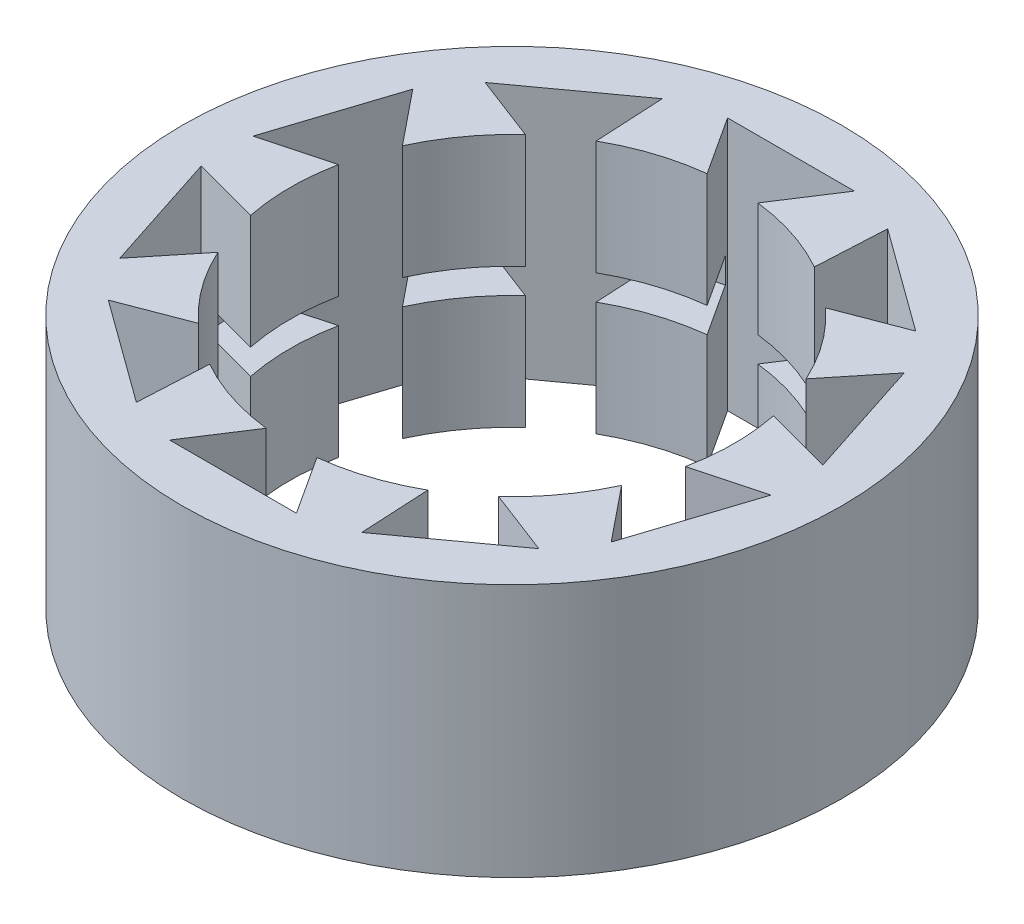
from build123d import *

# Parameters (mm, degrees)
SKETCH1_R           = 33.02
SKETCH1_R_2         = 22.225
BOSS_EXTRUDE1_DEPTH = 25.4
CAVITY1_DEPTH       = 25.4
CAVITY1_START       = 11.43
CAVITY1_2_DEPTH     = 2.54


# Read off the part's stored shape, not the designer's step: Cavity1
with BuildPart() as part:
    # Sketch1 → Boss-Extrude1 (new body)
    with BuildSketch(Plane(origin=(0, 0, 0), x_dir=(1, 0, 0), z_dir=(0, 1, 0))):
        with Locations(Location((0, 0, 0), (0, 0, 270))):
            Circle(SKETCH1_R)
        with Locations(Location((0, 0, 0), (0, 0, 270))):
            Circle(SKETCH1_R_2, mode=Mode.SUBTRACT)
    extrude(amount=BOSS_EXTRUDE1_DEPTH)

    # Cavity1 outline → Cavity1 (cut)
    with BuildSketch(Plane(origin=(0, 0, 0), x_dir=(1, 0, 0), z_dir=(0, 1, 0))):
        with BuildLine():
            Line((-6.35, -27.94), (6.35, -27.94))
            Line((6.35, -27.94), (2.54, -22.079380086))
            ThreePointArc((2.54, -22.079380086), (0, -22.225), (-2.54, -22.079380086))
            Line((-2.54, -22.079380086), (-6.35, -27.94))
        make_face()
        with BuildLine():
            Line((10.923030829, -19.355568256), (11.285462035, -26.336371175))
            Line((11.285462035, -26.336371175), (21.559977863, -18.871498471))
            Line((21.559977863, -18.871498471), (15.03283716, -16.369619174))
            ThreePointArc((15.03283716, -16.369619174), (13.063527232, -17.9804027), (10.923030829, -19.355568256))
        make_face()
        with BuildLine():
            Line((-11.285462035, -26.336371175), (-10.923030829, -19.355568256))
            ThreePointArc((-10.923030829, -19.355568256), (-13.063527232, -17.9804027), (-15.03283716, -16.369619174))
            Line((-15.03283716, -16.369619174), (-21.559977863, -18.871498471))
            Line((-21.559977863, -18.871498471), (-11.285462035, -26.336371175))
        make_face()
        with BuildLine():
            ThreePointArc((21.783641473, -4.407220121), (21.137231075, -6.8679027), (20.213835141, -9.238587223))
            Line((20.213835141, -9.238587223), (24.610261151, -14.673143701))
            Line((24.610261151, -14.673143701), (28.53477698, -2.594725944))
            Line((28.53477698, -2.594725944), (21.783641473, -4.407220121))
        make_face()
        with BuildLine():
            Line((-24.610261151, -14.673143701), (-20.213835141, -9.238587223))
            ThreePointArc((-20.213835141, -9.238587223), (-21.137231075, -6.8679027), (-21.783641473, -4.407220121))
            Line((-21.783641473, -4.407220121), (-28.53477698, -2.594725944))
            Line((-28.53477698, -2.594725944), (-24.610261151, -14.673143701))
        make_face()
        with BuildLine():
            Line((-28.53477698, 2.594725944), (-21.783641473, 4.407220121))
            ThreePointArc((-21.783641473, 4.407220121), (-21.137231075, 6.8679027), (-20.213835141, 9.238587223))
            Line((-20.213835141, 9.238587223), (-24.610261151, 14.673143701))
            Line((-24.610261151, 14.673143701), (-28.53477698, 2.594725944))
        make_face()
        with BuildLine():
            Line((21.783641473, 4.407220121), (28.53477698, 2.594725944))
            Line((28.53477698, 2.594725944), (24.610261151, 14.673143701))
            Line((24.610261151, 14.673143701), (20.213835141, 9.238587223))
            ThreePointArc((20.213835141, 9.238587223), (21.137231075, 6.8679027), (21.783641473, 4.407220121))
        make_face()
        with BuildLine():
            Line((-21.559977863, 18.871498471), (-15.03283716, 16.369619174))
            ThreePointArc((-15.03283716, 16.369619174), (-13.063527232, 17.9804027), (-10.923030829, 19.355568256))
            Line((-10.923030829, 19.355568256), (-11.285462035, 26.336371175))
            Line((-11.285462035, 26.336371175), (-21.559977863, 18.871498471))
        make_face()
        with BuildLine():
            ThreePointArc((10.923030829, 19.355568256), (13.063527232, 17.9804027), (15.03283716, 16.369619174))
            Line((15.03283716, 16.369619174), (21.559977863, 18.871498471))
            Line((21.559977863, 18.871498471), (11.285462035, 26.336371175))
            Line((11.285462035, 26.336371175), (10.923030829, 19.355568256))
        make_face()
        with BuildLine():
            Line((-6.35, 27.94), (-2.54, 22.079380086))
            ThreePointArc((-2.54, 22.079380086), (0, 22.225), (2.54, 22.079380086))
            Line((2.54, 22.079380086), (6.35, 27.94))
            Line((6.35, 27.94), (-6.35, 27.94))
        make_face()
    extrude(amount=CAVITY1_DEPTH, mode=Mode.SUBTRACT)

    # Cavity1 2 outline → Cavity1 2 (cut)
    with BuildSketch(Plane(origin=(0, 0, 0), x_dir=(1, 0, 0), z_dir=(0, 1, 0)).offset(CAVITY1_START)):
        with BuildLine():
            Line((2.54, -22.079380086), (5.935416317, -27.3022789))
            ThreePointArc((5.935416317, -27.3022789), (8.633934823, -26.572519065), (11.246024223, -25.576757793))
            Line((11.246024223, -25.576757793), (10.923030829, -19.355568256))
            ThreePointArc((10.923030829, -19.355568256), (6.8679027, -21.137231075), (2.54, -22.079380086))
        make_face()
        with BuildLine():
            ThreePointArc((-11.246024223, -25.576757793), (-8.633934823, -26.572519065), (-5.935416317, -27.3022789))
            Line((-5.935416317, -27.3022789), (-2.54, -22.079380086))
            ThreePointArc((-2.54, -22.079380086), (-6.8679027, -21.137231075), (-10.923030829, -19.355568256))
            Line((-10.923030829, -19.355568256), (-11.246024223, -25.576757793))
        make_face()
        with BuildLine():
            ThreePointArc((20.213835141, -9.238587223), (17.9804027, -13.063527232), (15.03283716, -16.369619174))
            Line((15.03283716, -16.369619174), (20.84972956, -18.599257438))
            ThreePointArc((20.84972956, -18.599257438), (22.603934823, -16.422719949), (24.131865747, -14.08178453))
            Line((24.131865747, -14.08178453), (20.213835141, -9.238587223))
        make_face()
        with BuildLine():
            Line((-20.84972956, -18.599257438), (-15.03283716, -16.369619174))
            ThreePointArc((-15.03283716, -16.369619174), (-17.9804027, -13.063527232), (-20.213835141, -9.238587223))
            Line((-20.213835141, -9.238587223), (-24.131865747, -14.08178453))
            ThreePointArc((-24.131865747, -14.08178453), (-22.603934823, -16.422719949), (-20.84972956, -18.599257438))
        make_face()
        with BuildLine():
            ThreePointArc((21.783641473, 4.407220121), (22.225, 0), (21.783641473, -4.407220121))
            Line((21.783641473, -4.407220121), (27.800154768, -2.7919518))
            ThreePointArc((27.800154768, -2.7919518), (27.94, 0), (27.800154768, 2.7919518))
            Line((27.800154768, 2.7919518), (21.783641473, 4.407220121))
        make_face()
        with BuildLine():
            Line((-27.800154768, -2.7919518), (-21.783641473, -4.407220121))
            ThreePointArc((-21.783641473, -4.407220121), (-22.225, 0), (-21.783641473, 4.407220121))
            Line((-21.783641473, 4.407220121), (-27.800154768, 2.7919518))
            ThreePointArc((-27.800154768, 2.7919518), (-27.94, 0), (-27.800154768, -2.7919518))
        make_face()
        with BuildLine():
            Line((-24.131865747, 14.08178453), (-20.213835141, 9.238587223))
            ThreePointArc((-20.213835141, 9.238587223), (-17.9804027, 13.063527232), (-15.03283716, 16.369619174))
            Line((-15.03283716, 16.369619174), (-20.84972956, 18.599257438))
            ThreePointArc((-20.84972956, 18.599257438), (-22.603934823, 16.422719949), (-24.131865747, 14.08178453))
        make_face()
        with BuildLine():
            ThreePointArc((15.03283716, 16.369619174), (17.9804027, 13.063527232), (20.213835141, 9.238587223))
            Line((20.213835141, 9.238587223), (24.131865747, 14.08178453))
            ThreePointArc((24.131865747, 14.08178453), (22.603934823, 16.422719949), (20.84972956, 18.599257438))
            Line((20.84972956, 18.599257438), (15.03283716, 16.369619174))
        make_face()
        with BuildLine():
            Line((-11.246024223, 25.576757793), (-10.923030829, 19.355568256))
            ThreePointArc((-10.923030829, 19.355568256), (-6.8679027, 21.137231075), (-2.54, 22.079380086))
            Line((-2.54, 22.079380086), (-5.935416317, 27.3022789))
            ThreePointArc((-5.935416317, 27.3022789), (-8.633934823, 26.572519065), (-11.246024223, 25.576757793))
        make_face()
        with BuildLine():
            ThreePointArc((2.54, 22.079380086), (6.8679027, 21.137231075), (10.923030829, 19.355568256))
            Line((10.923030829, 19.355568256), (11.246024223, 25.576757793))
            ThreePointArc((11.246024223, 25.576757793), (8.633934823, 26.572519065), (5.935416317, 27.3022789))
            Line((5.935416317, 27.3022789), (2.54, 22.079380086))
        make_face()
    extrude(amount=CAVITY1_2_DEPTH, mode=Mode.SUBTRACT)


solid = part.part
